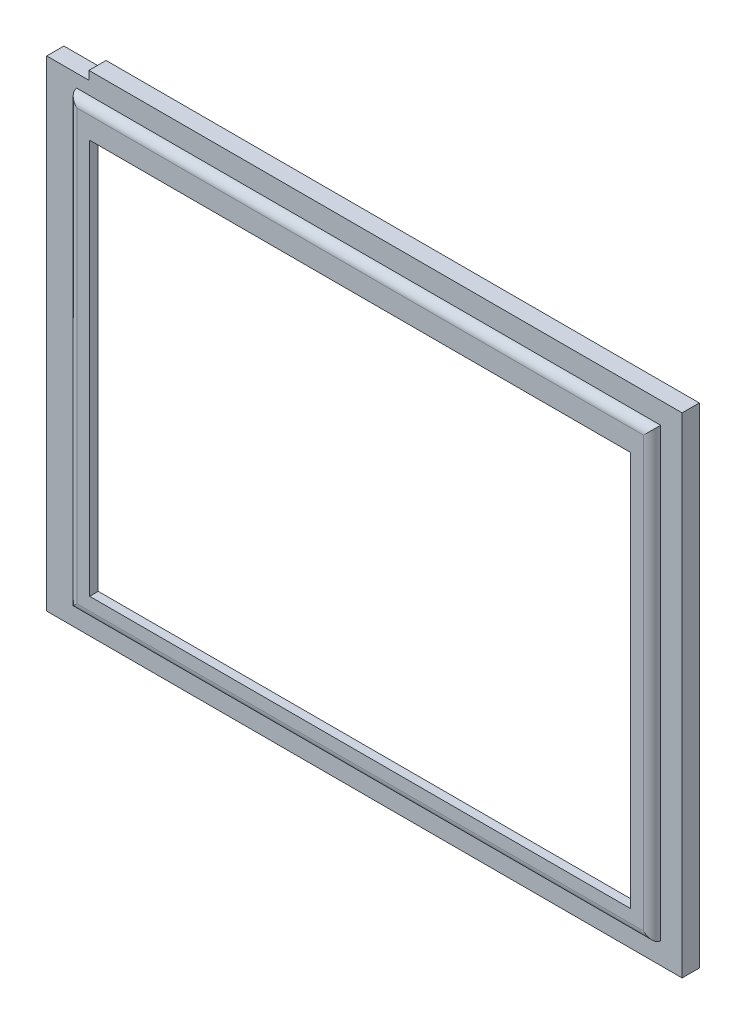
from build123d import *

# Parameters (mm, degrees)
ESBO_O2_W                = 740
ESBO_O2_H                = 570
ESBO_O2_W_2              = 680
ESBO_O2_H_2              = 520
RESSALTO_EXTRUS_O1_DEPTH = 20
ESBO_O3_W                = 680
ESBO_O3_H                = 520
ESBO_O3_W_2              = 630
ESBO_O3_H_2              = 460
RESSALTO_EXTRUS_O2_DEPTH = 10
FILETE1_R                = 10
ESBO_O4_W                = 49.143238
ESBO_O4_H                = 10
CORTE_EXTRUS_O1_DEPTH    = 20


with BuildPart() as part:
    # Esboço2 → Ressalto-extrusão1 (new body)
    with BuildSketch(Plane.XY):
        with Locations((370, -285)):
            Rectangle(ESBO_O2_W, ESBO_O2_H)
        with Locations((375, -285)):
            Rectangle(ESBO_O2_W_2, ESBO_O2_H_2, mode=Mode.SUBTRACT)
    extrude(amount=RESSALTO_EXTRUS_O1_DEPTH)

    # Esboço4 → Corte-extrusão1 (cut)
    with BuildSketch(Plane.XY.offset(20)):
        with Locations((24.571619, -5)):
            Rectangle(ESBO_O4_W, ESBO_O4_H)
    extrude(amount=-CORTE_EXTRUS_O1_DEPTH, mode=Mode.SUBTRACT)


with BuildPart() as body_2:
    # Esboço3 → Ressalto-extrusão2 (new body)
    with BuildSketch(Plane.XY.offset(20)):
        with Locations((375, -285)):
            Rectangle(ESBO_O3_W, ESBO_O3_H)
        with Locations((375, -290)):
            Rectangle(ESBO_O3_W_2, ESBO_O3_H_2, mode=Mode.SUBTRACT)
    extrude(amount=RESSALTO_EXTRUS_O2_DEPTH)

    # Filete1
    filete1_edges = [body_2.edges().sort_by_distance(p)[0] for p in [
        (715, -285, 30),
        (375, -25, 30),
        (35, -285, 30),
        (375, -545, 30),
    ]]
    fillet(filete1_edges, radius=FILETE1_R - 0.0001)  # a hair under: the kernel refuses the full size


solid = Compound([part.part, body_2.part])
